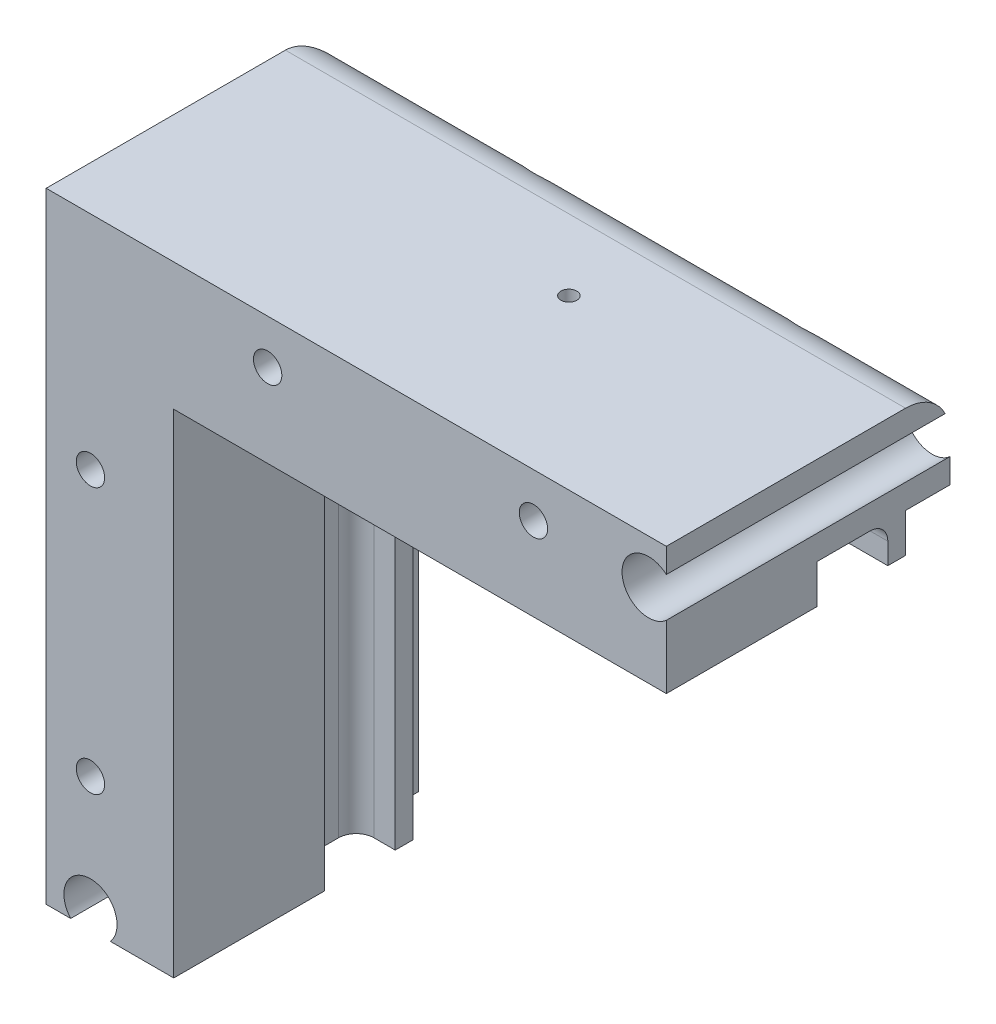
from build123d import *

# Parameters (mm, degrees)
SKETCH2_W           = 18.288
SKETCH2_H           = 40.64
BOSS_EXTRUDE1_DEPTH = 88.9
SKETCH3_W           = 40.64
SKETCH3_H           = 18.288
BOSS_EXTRUDE2_DEPTH = 70.612
SKETCH4_W           = 6.35
SKETCH4_H           = 5.588
SKETCH4_W_2         = 10.16
CUT_EXTRUDE1_DEPTH  = 76.2
SKETCH5_W           = 5.588
SKETCH5_H           = 6.35
SKETCH5_H_2         = 10.16
CUT_EXTRUDE2_DEPTH  = 76.2
SKETCH6_R           = 5.08
CUT_EXTRUDE3_DEPTH  = 15.24
SKETCH7_R           = 2.032
CUT_EXTRUDE4_DEPTH  = 133.128837125
FILLET1_R           = 2.54
FILLET2_R           = 6.35
SKETCH8_R           = 3.81
CUT_EXTRUDE5_DEPTH  = 133.12883729
CUT_EXTRUDE6_REACH  = 125.941
SKETCH9_R           = 1.143
CUT_EXTRUDE7_REACH  = 125.941
SKETCH10_R          = 1.143


with BuildPart() as part:
    # Sketch2 → Boss-Extrude1 (new body)
    with BuildSketch(Plane(origin=(0, 0, 0), x_dir=(1, 0, 0), z_dir=(0, 1, 0))):
        with Locations((9.144, 20.32)):
            Rectangle(SKETCH2_W, SKETCH2_H)
    extrude(amount=BOSS_EXTRUDE1_DEPTH)

    # Sketch3 → Boss-Extrude2 (add)
    with BuildSketch(Plane(origin=(18.288, 0, 0), x_dir=(0, 0, -1), z_dir=(1, 0, 0))):
        with Locations((20.32, 79.756)):
            Rectangle(SKETCH3_W, SKETCH3_H)
    extrude(amount=BOSS_EXTRUDE2_DEPTH)

    # Sketch4 → Cut-Extrude1 (cut)
    with BuildSketch(Plane(origin=(88.9, 0, 0), x_dir=(0, 0, -1), z_dir=(1, 0, 0))):
        with Locations((37.465, 73.406)):
            Rectangle(SKETCH4_W, SKETCH4_H)
        with Locations((26.67, 73.406)):
            Rectangle(SKETCH4_W_2, SKETCH4_H)
    extrude(amount=-CUT_EXTRUDE1_DEPTH, mode=Mode.SUBTRACT)

    # Sketch5 → Cut-Extrude2 (cut)
    with BuildSketch(Plane.XZ):
        with Locations((15.494, -37.465)):
            Rectangle(SKETCH5_W, SKETCH5_H)
        with Locations((15.494, -26.67)):
            Rectangle(SKETCH5_W, SKETCH5_H_2)
    extrude(amount=-CUT_EXTRUDE2_DEPTH, mode=Mode.SUBTRACT)

    # Sketch6 → Cut-Extrude3 (cut)
    with BuildSketch(Plane(origin=(0, 0, -40.64), x_dir=(-1, 0, 0), z_dir=(0, 0, -1))):
        with Locations((-6.35, 19.05)):
            Circle(SKETCH6_R)
        with Locations((-6.35, 57.15)):
            Circle(SKETCH6_R)
        with Locations((-31.75, 82.55)):
            Circle(SKETCH6_R)
        with Locations((-69.85, 82.55)):
            Circle(SKETCH6_R)
    extrude(amount=-CUT_EXTRUDE3_DEPTH, mode=Mode.SUBTRACT)

    # Sketch7 → Cut-Extrude4 (cut, through all)
    with BuildSketch(Plane(origin=(0, 0, -40.64), x_dir=(-1, 0, 0), z_dir=(0, 0, -1))):
        with Locations((-69.85, 82.55)):
            Circle(SKETCH7_R)
        with Locations((-6.35, 57.15)):
            Circle(SKETCH7_R)
        with Locations((-31.75, 82.55)):
            Circle(SKETCH7_R)
        with Locations((-6.35, 19.05)):
            Circle(SKETCH7_R)
    extrude(amount=-CUT_EXTRUDE4_DEPTH, mode=Mode.SUBTRACT)

    # Fillet1
    fillet1_edges = [part.edges().sort_by_distance(p)[0] for p in [
        (12.7, 38.1, -31.75),
        (50.8, 76.2, -31.75),
    ]]
    fillet(fillet1_edges, radius=FILLET1_R)

    # Fillet2
    # the kernel refuses this fillet: 6.35 mm, written as the material it takes off along each edge
    with BuildSketch(Plane(origin=(104.775, 88.9, -40.64), x_dir=(0, -1, 0), z_dir=(-1, 0, 0))) as fillet2_piece_1:
        with BuildLine():
            CenterArc((FILLET2_R, FILLET2_R), FILLET2_R, 180, 90)
            Line((0, FILLET2_R), (0, 0))
            Line((0, 0), (FILLET2_R, 0))
        make_face()
    extrude(amount=120.65, mode=Mode.SUBTRACT)
    with BuildSketch(Plane(origin=(0, -15.875, -40.64), x_dir=(1, 0, 0), z_dir=(0, 1, 0))) as fillet2_piece_2:
        with BuildLine():
            CenterArc((FILLET2_R, -FILLET2_R), FILLET2_R, 90, 90)
            Line((0, -FILLET2_R), (0, 0))
            Line((0, 0), (FILLET2_R, 0))
        make_face()
    extrude(amount=120.65, mode=Mode.SUBTRACT)

    # Sketch8 → Cut-Extrude5 (cut, through all)
    with BuildSketch(Plane.XY):
        with Locations((6.35, 2.54)):
            Circle(SKETCH8_R)
        with Locations((86.36, 82.55)):
            Circle(SKETCH8_R)
    extrude(amount=-CUT_EXTRUDE5_DEPTH, mode=Mode.SUBTRACT)

    # Sketch9 → Cut-Extrude6 (cut, up to next)
    with BuildSketch(Plane.XZ.offset(-76.2), mode=Mode.PRIVATE) as cut_extrude6_sk1:
        with Locations((50.8, -24.13)):
            Circle(SKETCH9_R)
    cut_extrude6_tool1 = extrude(cut_extrude6_sk1.sketch, amount=-CUT_EXTRUDE6_REACH, mode=Mode.PRIVATE) & part.part
    add(cut_extrude6_tool1.solids().sort_by_distance((50.8, 76.2, -24.13))[0], mode=Mode.SUBTRACT)

    # Sketch10 → Cut-Extrude7 (cut, up to next)
    with BuildSketch(Plane(origin=(12.7, 0, 0), x_dir=(0, 0, -1), z_dir=(1, 0, 0)), mode=Mode.PRIVATE) as cut_extrude7_sk1:
        with Locations((24.13, 38.1)):
            Circle(SKETCH10_R)
    cut_extrude7_tool1 = extrude(cut_extrude7_sk1.sketch, amount=-CUT_EXTRUDE7_REACH, mode=Mode.PRIVATE) & part.part
    add(cut_extrude7_tool1.solids().sort_by_distance((12.7, 38.1, -24.13))[0], mode=Mode.SUBTRACT)


solid = part.part
